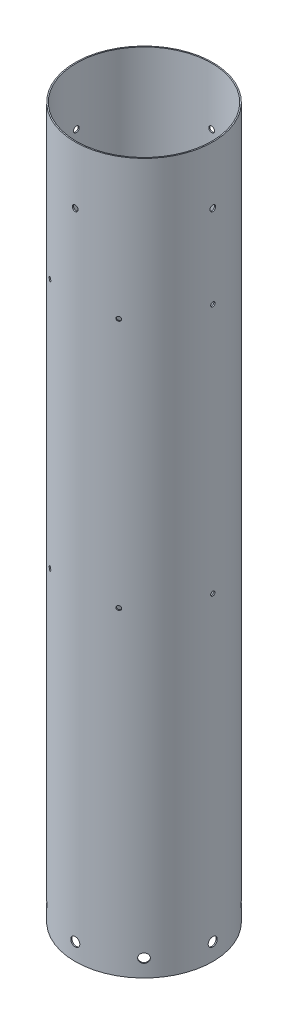
from build123d import *

# Parameters (mm, degrees)
SKETCH2_R                           = 76.2
SKETCH2_R_2                         = 74.93
BOSS_EXTRUDE1_DEPTH                 = 785.495
N2_TO_LOX_LOX_SIDE_HOLES_REACH      = 820.024
N2_TO_LOX_LOX_SIDE_HOLES_END_RADIUS = 76.2
SKETCH5_R                           = 5.0165
CIRPATTERN3_COUNT                   = 8
SKETCH7_R                           = 2.381249991
SKETCH7_R_2                         = 2.378452315
CUT_EXTRUDE2_DEPTH                  = 793.852618847
CIRPATTERN4_COUNT                   = 4
CIRPATTERN4_ANGLE                   = 180
SKETCH9_R                           = 3.175
CUT_EXTRUDE3_DEPTH                  = 793.852618848
CIRPATTERN5_COUNT                   = 3
CIRPATTERN5_ANGLE                   = 180


with BuildPart() as part:
    # Sketch2 → Boss-Extrude1 (new body)
    with BuildSketch(Plane(origin=(0, 0, 0), x_dir=(1, 0, 0), z_dir=(0, 1, 0))):
        Circle(SKETCH2_R)
        Circle(SKETCH2_R_2, mode=Mode.SUBTRACT)
    extrude(amount=BOSS_EXTRUDE1_DEPTH)

    # N2 to LOX, LOX Side Holes: up to this cylinder (the profile starts inside it)
    n2_to_lox_lox_side_holes_end = Plane(origin=(0, 19.05, 0), z_dir=(0, -1, 0)) * Cylinder(N2_TO_LOX_LOX_SIDE_HOLES_END_RADIUS, 1793.448, mode=Mode.PRIVATE)
    # Sketch5 → N2 to LOX, LOX Side Holes (cut, up to the surface)
    with BuildSketch(Plane(origin=(0, -25.4, 0), x_dir=(0, 0, 1), z_dir=(1, 0, 0)), mode=Mode.PRIVATE) as n2_to_lox_lox_side_holes_sk1:
        with Locations((0, -44.45)):
            Circle(SKETCH5_R)
    n2_to_lox_lox_side_holes_tool1 = extrude(n2_to_lox_lox_side_holes_sk1.sketch, amount=N2_TO_LOX_LOX_SIDE_HOLES_REACH, mode=Mode.PRIVATE) & n2_to_lox_lox_side_holes_end
    n2_to_lox_lox_side_holes = n2_to_lox_lox_side_holes_tool1.solids().sort_by_distance((0, 19.05, 0))[0]
    add(n2_to_lox_lox_side_holes, mode=Mode.SUBTRACT)

    # CirPattern3: N2 to LOX, LOX Side Holes ×8 about axis
    cirpattern3_axis = Axis((0, 0, 0), (0, 1, 0))
    for i in range(1, CIRPATTERN3_COUNT):
        add(n2_to_lox_lox_side_holes.rotate(cirpattern3_axis, i * 360 / CIRPATTERN3_COUNT), mode=Mode.SUBTRACT)

    # Sketch7 → Cut-Extrude2 (cut, symmetric)
    with BuildSketch(Plane(origin=(0, 0, 0), x_dir=(0, 0, -1), z_dir=(1, 0, 0))):
        with Locations((-4e-09, 629.919999983)):
            Circle(SKETCH7_R)
        with Locations((-4e-09, 352.73028923)):
            Circle(SKETCH7_R_2)
    cut_extrude2 = extrude(amount=CUT_EXTRUDE2_DEPTH, both=True, mode=Mode.SUBTRACT)

    # CirPattern4: Cut-Extrude2 ×4 about axis
    cirpattern4_axis = Axis((0, 785.495, 0), (0, -1, 0))
    for i in range(1, CIRPATTERN4_COUNT):
        add(cut_extrude2.rotate(cirpattern4_axis, i * CIRPATTERN4_ANGLE / (CIRPATTERN4_COUNT - 1)), mode=Mode.SUBTRACT)

    # Sketch9 → Cut-Extrude3 (cut, symmetric)
    with BuildSketch(Plane(origin=(0, 0, 0), x_dir=(0, 0, -1), z_dir=(1, 0, 0))):
        with Locations((0, 721.995)):
            Circle(SKETCH9_R)
    cut_extrude3 = extrude(amount=CUT_EXTRUDE3_DEPTH, both=True, mode=Mode.SUBTRACT)

    # CirPattern5: Cut-Extrude3 ×3 about axis
    cirpattern5_axis = Axis((0, 785.495, 0), (0, -1, 0))
    for i in range(1, CIRPATTERN5_COUNT):
        add(cut_extrude3.rotate(cirpattern5_axis, i * CIRPATTERN5_ANGLE / (CIRPATTERN5_COUNT - 1)), mode=Mode.SUBTRACT)


solid = part.part
